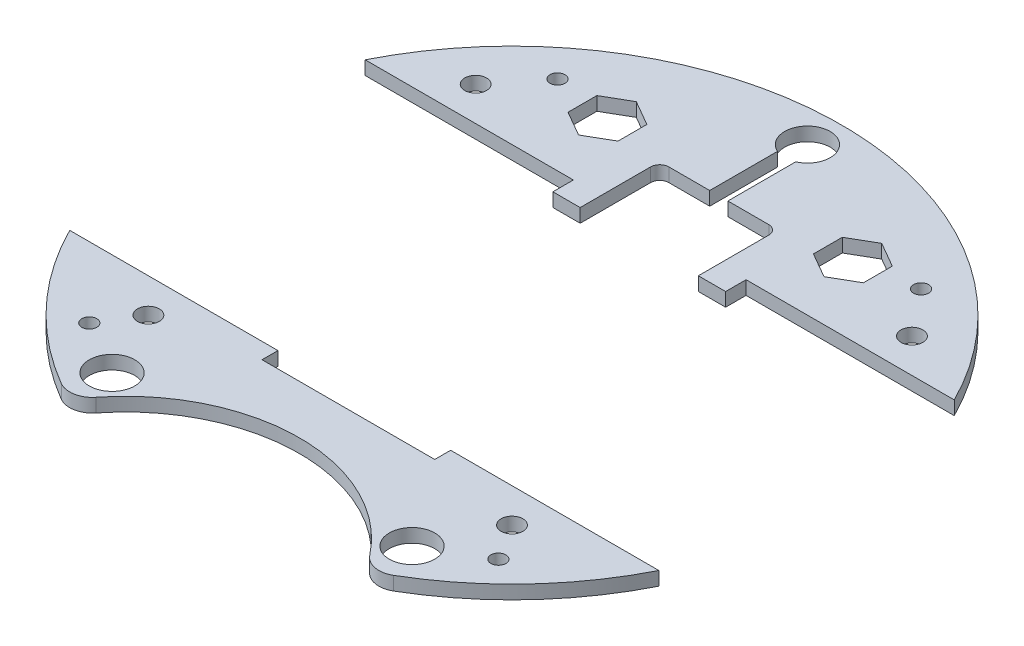
from build123d import *

# Parameters (mm, degrees)
BOSS_EXTRUDE1_DEPTH  = 3
SOLENOID_PLACEMENT_W = 38
SOLENOID_PLACEMENT_H = 64
CUT_EXTRUDE1_DEPTH   = 103.574363269
CUT_EXTRUDE5_DEPTH   = 103.574363269
SKETCH6_R            = 2.4
CUT_EXTRUDE6_DEPTH   = 103.574363269
CUT_EXTRUDE3_DEPTH   = 103.574363269
CUT_EXTRUDE7_DEPTH   = 98.289516393
SKETCH8_R            = 5
CUT_EXTRUDE8_DEPTH   = 98.289516393
CUT_EXTRUDE9_DEPTH   = 98.289516393
SKETCH10_R           = 1.65
CUT_EXTRUDE10_DEPTH  = 10


with BuildPart() as part:
    # Sketch1 → Boss-Extrude1 (new body)
    with BuildSketch(Plane(origin=(0, 0, 0), x_dir=(1, 0, 0), z_dir=(0, 1, 0))):
        with BuildLine():
            ThreePointArc((36.543377003, -62.616544118), (0, 72.5), (-36.543377003, -62.616544118))
            ThreePointArc((-36.543377003, -62.616544118), (-33.085954668, -63.20954405), (-30.089832649, -61.38507948))
            ThreePointArc((-30.089832649, -61.38507948), (0, -46.75), (30.089832649, -61.38507948))
            ThreePointArc((30.089832649, -61.38507948), (33.085954668, -63.20954405), (36.543377003, -62.616544118))
        make_face()
    extrude(amount=BOSS_EXTRUDE1_DEPTH)

    # solenoid placement → Cut-Extrude1 (cut, through all)
    with BuildSketch(Plane(origin=(0, 3, 0), x_dir=(1, 0, 0), z_dir=(0, 1, 0))):
        with Locations((0, -4)):
            Rectangle(SOLENOID_PLACEMENT_W, SOLENOID_PLACEMENT_H)
    extrude(amount=-CUT_EXTRUDE1_DEPTH, mode=Mode.SUBTRACT)

    # Sketch5 → Cut-Extrude5 (cut, through all)
    with BuildSketch(Plane(origin=(0, 3, 0), x_dir=(1, 0, 0), z_dir=(0, 1, 0))):
        Polygon((-21.5, 51.175426481), (-27, 54.350852961), (-32.5, 51.175426481), (-32.5, 44.824573519), (-27, 41.649147039), (-21.5, 44.824573519), align=None)
        Polygon((21.5, 51.175426481), (21.5, 44.824573519), (27, 41.649147039), (32.5, 44.824573519), (32.5, 51.175426481), (27, 54.350852961), align=None)
    extrude(amount=-CUT_EXTRUDE5_DEPTH, mode=Mode.SUBTRACT)

    # Sketch6 → Cut-Extrude6 (cut, through all)
    with BuildSketch(Plane(origin=(0, 3, 0), x_dir=(1, 0, 0), z_dir=(0, 1, 0))):
        with Locations((48, 40)):
            Circle(SKETCH6_R)
        with Locations((-48, 40)):
            Circle(SKETCH6_R)
        with Locations((40, -40)):
            Circle(SKETCH6_R)
        with Locations((-40, -40)):
            Circle(SKETCH6_R)
    extrude(amount=-CUT_EXTRUDE6_DEPTH, mode=Mode.SUBTRACT)

    # Sketch3 → Cut-Extrude3 (cut, through all)
    with BuildSketch(Plane(origin=(0, 3, 0), x_dir=(1, 0, 0), z_dir=(0, 1, 0))):
        Polygon((-19, 28), (-19, 32.5), (-72.5, 32.5), (-72.5, -32.5), (72.5, -32.5), (72.5, 32.5), (19, 32.5), (19, 28), align=None)
    extrude(amount=-CUT_EXTRUDE3_DEPTH, mode=Mode.SUBTRACT)


with BuildPart() as cut_extrude3_piece_1:
    # of the separate pieces the step leaves, piece 1, a body of its own (cut_extrude3_pieces)
    add(part.part.solids().sort_by_distance((64.807406984, 0, -32.5))[0])

    # Sketch7 → Cut-Extrude7 (cut, through all)
    with BuildSketch(Plane(origin=(0, 3, 0), x_dir=(1, 0, 0), z_dir=(0, 1, 0))):
        with BuildLine():
            Line((13, 28), (13, 43.5))
            ThreePointArc((13, 43.5), (12.414213562, 44.914213562), (11, 45.5))
            Line((11, 45.5), (-11, 45.5))
            ThreePointArc((-11, 45.5), (-12.414213562, 44.914213562), (-13, 43.5))
            Line((-13, 43.5), (-13, 28))
            Line((-13, 28), (13, 28))
        make_face()
    extrude(amount=-CUT_EXTRUDE7_DEPTH, mode=Mode.SUBTRACT)

    # Sketch9 → Cut-Extrude9 (cut, through all)
    with BuildSketch(Plane(origin=(0, 3, 0), x_dir=(1, 0, 0), z_dir=(0, 1, 0))):
        with BuildLine():
            Line((2, 0), (2, 60.417424305))
            ThreePointArc((2, 60.417424305), (0, 70), (-2, 60.417424305))
            Line((-2, 60.417424305), (-2, 0))
            ThreePointArc((-2, 0), (0, -2), (2, 0))
        make_face()
    extrude(amount=-CUT_EXTRUDE9_DEPTH, mode=Mode.SUBTRACT)


with BuildPart() as cut_extrude3_piece_2:
    # of the separate pieces the step leaves, piece 2, a body of its own (cut_extrude3_pieces)
    add(part.part.solids().sort_by_distance((-36.543377003, 0, 62.616544118))[0])

    # Sketch8 → Cut-Extrude8 (cut, through all)
    with BuildSketch(Plane(origin=(0, 3, 0), x_dir=(1, 0, 0), z_dir=(0, 1, 0))):
        with Locations((33, -55)):
            Circle(SKETCH8_R)
        with Locations((-33, -55)):
            Circle(SKETCH8_R)
    extrude(amount=-CUT_EXTRUDE8_DEPTH, mode=Mode.SUBTRACT)


with BuildPart() as cut_extrude10_tool:
    # Sketch10 → Cut-Extrude10 (new body)
    with BuildSketch(Plane(origin=(0, 3, 0), x_dir=(1, 0, 0), z_dir=(0, 1, 0))):
        with Locations((45, -48)):
            Circle(SKETCH10_R)
        with Locations((-45, -48)):
            Circle(SKETCH10_R)
        with Locations((40, 50)):
            Circle(SKETCH10_R)
        with Locations((-40, 50)):
            Circle(SKETCH10_R)
    extrude(amount=-CUT_EXTRUDE10_DEPTH)


with BuildPart() as cut_extrude3_piece_1_1:
    add(cut_extrude3_piece_1.part)

    # Cut-Extrude10: cut by cut_extrude10_tool
    add(cut_extrude10_tool.part, mode=Mode.SUBTRACT)


with BuildPart() as cut_extrude3_piece_2_1:
    add(cut_extrude3_piece_2.part)

    # Cut-Extrude10: cut by cut_extrude10_tool
    add(cut_extrude10_tool.part, mode=Mode.SUBTRACT)


solid = Compound([cut_extrude3_piece_1_1.part, cut_extrude3_piece_2_1.part])
